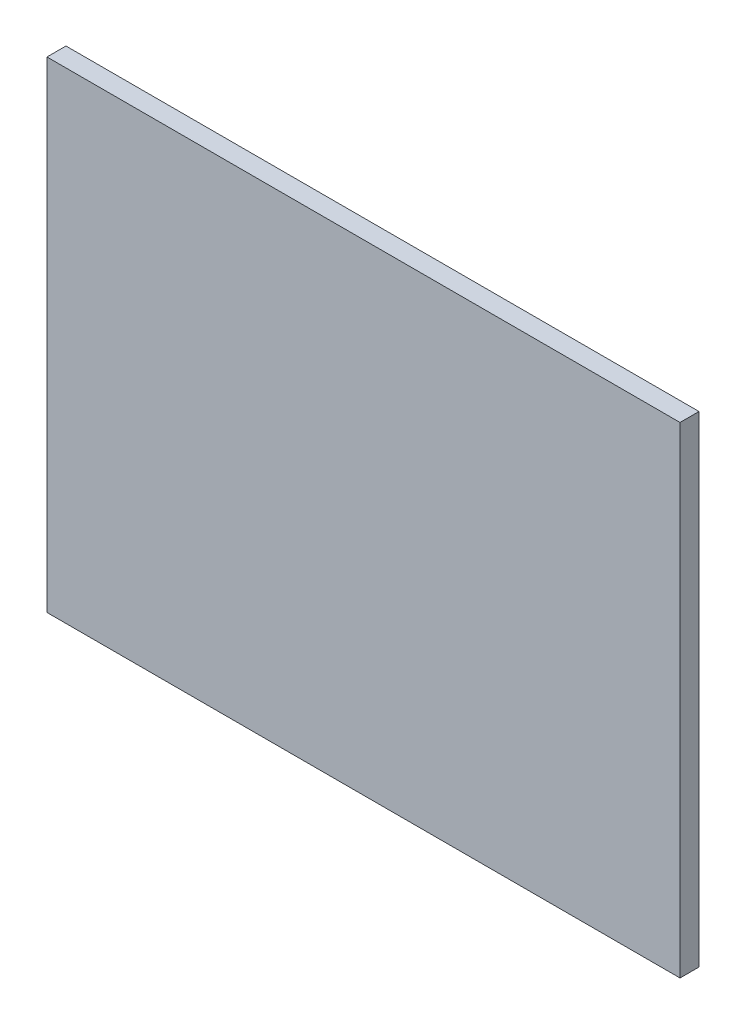
from build123d import *

# Parameters (mm, degrees)
ESQUISSE1_W        = 100
ESQUISSE1_H        = 76
BOSS_EXTRU_1_DEPTH = 3


with BuildPart() as part:
    # Esquisse1 → Boss.-Extru.1 (new body)
    with BuildSketch(Plane.XY):
        with Locations((50, 38)):
            Rectangle(ESQUISSE1_W, ESQUISSE1_H)
    extrude(amount=BOSS_EXTRU_1_DEPTH)


solid = part.part
